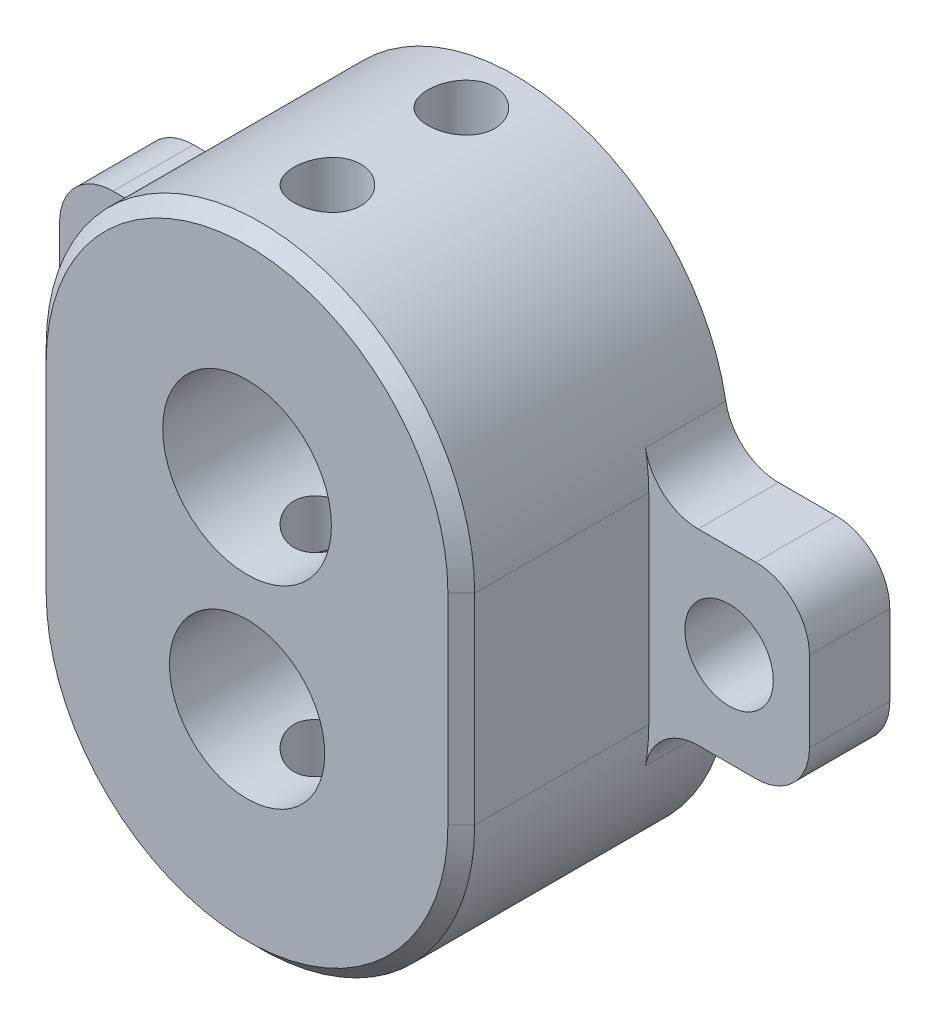
from build123d import *

# Parameters (mm, degrees)
SKETCH1_R            = 3.15
SKETCH1_R_2          = 2.9
BOSS_EXTRUDE1_DEPTH  = 10
SKETCH2_R            = 1.25
CUT_EXTRUDE1_DEPTH   = 21.105969263
CHAMFER1_SIZE        = 0.5
SKETCH3_R            = 1.25
CUT_EXTRUDE2_DEPTH   = 21.105969352
SKETCH4_W            = 6
SKETCH4_H            = 7
BOSS_EXTRUDE2_DEPTH  = 3
SKETCH5_R            = 1.65
CUT_EXTRUDE3_DEPTH   = 24.157072484
FILLET1_R            = 2
FILLET1_OF_MIRROR1_R = 2
FILLET2_R            = 2
CUT_EXTRUDE4_DEPTH   = 5


with BuildPart() as part:
    # Sketch1 → Boss-Extrude1 (new body)
    with BuildSketch(Plane.XY):
        with BuildLine():
            Line((8, 0), (8, -7.5))
            ThreePointArc((8, -7.5), (0, -15.5), (-8, -7.5))
            Line((-8, -7.5), (-8, 0))
            ThreePointArc((-8, 0), (0, 8), (8, 0))
        make_face()
        Circle(SKETCH1_R, mode=Mode.SUBTRACT)
        with Locations((0, -7.5)):
            Circle(SKETCH1_R_2, mode=Mode.SUBTRACT)
    extrude(amount=BOSS_EXTRUDE1_DEPTH)

    # Sketch2 → Cut-Extrude1 (cut, through all)
    with BuildSketch(Plane(origin=(0, 0, 0), x_dir=(1, 0, 0), z_dir=(0, 1, 0))):
        with Locations(Location((0, -2, 0), (0, 0, 90))):
            Circle(SKETCH2_R)
        with Locations(Location((0, -7, 0), (0, 0, 90))):
            Circle(SKETCH2_R)
    extrude(amount=CUT_EXTRUDE1_DEPTH, mode=Mode.SUBTRACT)

    # Chamfer1
    chamfer1_edges = [part.edges().sort_by_distance(p)[0] for p in [
        (0, -15.5, 10),
        (8, -3.75, 10),
        (0, 8, 10),
        (-8, -3.75, 10),
    ]]
    chamfer(chamfer1_edges, length=CHAMFER1_SIZE)

    # Sketch3 → Cut-Extrude2 (cut, through all)
    with BuildSketch(Plane(origin=(0, 0, 0), x_dir=(1, 0, 0), z_dir=(0, 1, 0))):
        with Locations(Location((0, -7, 0), (0, 0, 90))):
            Circle(SKETCH3_R)
    extrude(amount=-CUT_EXTRUDE2_DEPTH, mode=Mode.SUBTRACT)

    # Sketch4 → Boss-Extrude2 (add)
    with BuildSketch(Plane(origin=(0, 0, 0), x_dir=(-1, 0, 0), z_dir=(0, 0, -1))):
        with Locations((-11, -3.75)):
            Rectangle(SKETCH4_W, SKETCH4_H)
    boss_extrude2 = extrude(amount=-BOSS_EXTRUDE2_DEPTH)

    # Sketch5 → Cut-Extrude3 (cut, through all)
    with BuildSketch(Plane(origin=(0, 0, 0), x_dir=(-1, 0, 0), z_dir=(0, 0, -1))):
        with Locations((-11, -3.75)):
            Circle(SKETCH5_R)
    cut_extrude3 = extrude(amount=-CUT_EXTRUDE3_DEPTH, mode=Mode.SUBTRACT)

    # Fillet1
    fillet1_edges = [part.edges().sort_by_distance(p)[0] for p in [
        (14, -7.25, 1.5),
        (14, -0.25, 1.5),
    ]]
    fillet(fillet1_edges, radius=FILLET1_R)

    # Mirror1: Boss-Extrude2, Cut-Extrude3 across plane
    add(boss_extrude2.mirror(Plane(origin=(0, 0, 0), x_dir=(0, 0, 1), z_dir=(1, 0, 0))))
    add(cut_extrude3.mirror(Plane(origin=(0, 0, 0), x_dir=(0, 0, 1), z_dir=(1, 0, 0))), mode=Mode.SUBTRACT)

    # Fillet1 of Mirror1
    fillet1_of_mirror1_edges = [part.edges().sort_by_distance(p)[0] for p in [
        (-14, -7.25, 1.5),
        (-14, -0.25, 1.5),
    ]]
    fillet(fillet1_of_mirror1_edges, radius=FILLET1_OF_MIRROR1_R)

    # Fillet2
    # the kernel refuses this fillet: 2 mm, written as the material it adds along each edge
    with BuildSketch(Plane(origin=(-8, -0.25, 0), x_dir=(-1, 0, 0), z_dir=(0, 0, 1))) as fillet2_piece_1:
        with BuildLine():
            CenterArc((1.845684334, -2), FILLET2_R, 90, 79.921341892)
            Line((-0.123452533, -1.65), (-0.32036622, -1.615))
            ThreePointArc((-0.32036622, -1.615), (-0.2, -0.25), (-0.2, 0))
            Line((-0.2, 0), (0, 0.2))
            Line((0, 0.2), (1.845684334, 0.2))
            Line((1.845684334, 0.2), (1.845684334, 0))
        make_face()
    extrude(amount=3)
    with BuildSketch(Plane(origin=(-8, -7.25, 0), x_dir=(0.07461117211724091, -0.9972127019825267, 0), z_dir=(0, 0, 1)), Plane(origin=(8, -0.25, 0), x_dir=(-0.07461117211724083, 0.9972127019825267, 0), z_dir=(0, 0, 1))) as fillet2_piece_2:
        with BuildLine():
            CenterArc((1.856716732, -1.989762206), FILLET2_R, 95.799776596, 79.921341892)
            Line((-0.137708672, -1.840539861), (-0.337151212, -1.825617627))
            Line((-0.337151212, -1.825617627), (-0.19944254, 0.014922234))
            Line((-0.19944254, 0.014922234), (0.014922234, 0.19944254))
            ThreePointArc((0.014922234, 0.19944254), (0.26422541, 0.180789747), (1.634401413, 0.198976221))
            Line((1.634401413, 0.198976221), (1.654611896, 0))
        make_face()
    extrude(amount=3)
    with BuildSketch(Plane(origin=(8, -7.25, 0), x_dir=(-0.07461117211724076, -0.9972127019825267, 0), z_dir=(0, 0, 1))) as fillet2_piece_3:
        with BuildLine():
            CenterArc((1.856716732, 1.989762206), FILLET2_R, 184.278881512, 79.921341892)
            Line((-0.137708672, 1.840539861), (-0.337151212, 1.825617627))
            Line((-0.337151212, 1.825617627), (-0.19944254, -0.014922234))
            Line((-0.19944254, -0.014922234), (0.014922234, -0.19944254))
            ThreePointArc((0.014922234, -0.19944254), (0.26422541, -0.180789747), (1.634401413, -0.198976221))
            Line((1.634401413, -0.198976221), (1.654611896, 0))
        make_face()
    extrude(amount=3)

    # Sketch6 → Cut-Extrude4 (cut)
    with BuildSketch(Plane(origin=(0, 0, 0), x_dir=(-1, 0, 0), z_dir=(0, 0, -1))):
        with BuildLine():
            Line((3.5, 0), (3.5, -7.5))
            ThreePointArc((3.5, -7.5), (0, -11), (-3.5, -7.5))
            Line((-3.5, -7.5), (-3.5, 0))
            ThreePointArc((-3.5, 0), (0, 3.5), (3.5, 0))
        make_face()
    extrude(amount=-CUT_EXTRUDE4_DEPTH, mode=Mode.SUBTRACT)


solid = part.part
